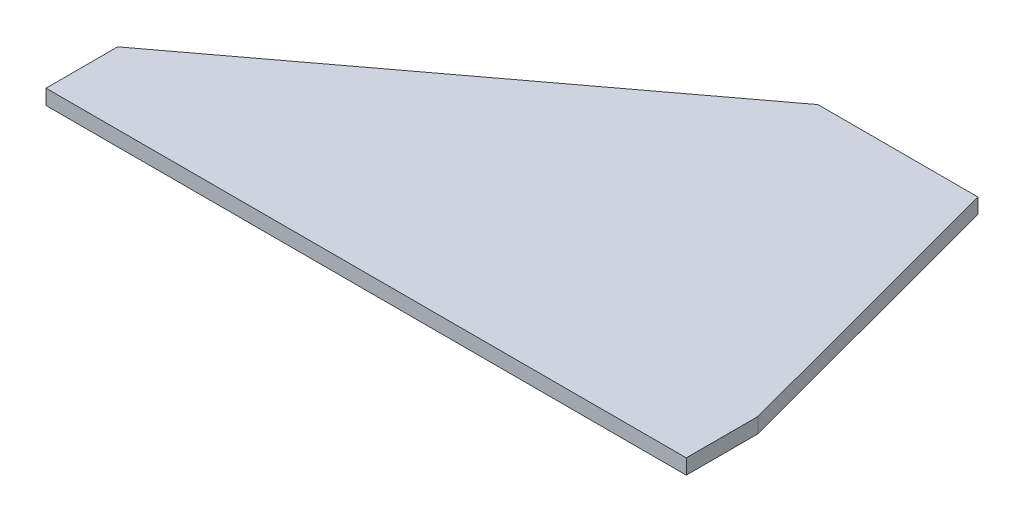
from build123d import *

# Parameters (mm, degrees)
BOSS_EXTRUDE1_DEPTH      = 2.38125
BOSS_EXTRUDE1_DEPTH_BACK = 2.38125


with BuildPart() as part:
    # Sketch1 → Boss-Extrude1 (new, two sides: drawn at the far end of the back side and taken through both)
    with BuildSketch(Plane(origin=(0, 0, 0), x_dir=(1, 0, 0), z_dir=(0, 1, 0)).offset(-BOSS_EXTRUDE1_DEPTH_BACK)):
        Polygon((0, 0), (0, 22.733), (127, 117.983), (177.8, 117.983), (203.2, 22.733), (203.2, 0), align=None)
    extrude(amount=BOSS_EXTRUDE1_DEPTH + BOSS_EXTRUDE1_DEPTH_BACK)


solid = part.part
